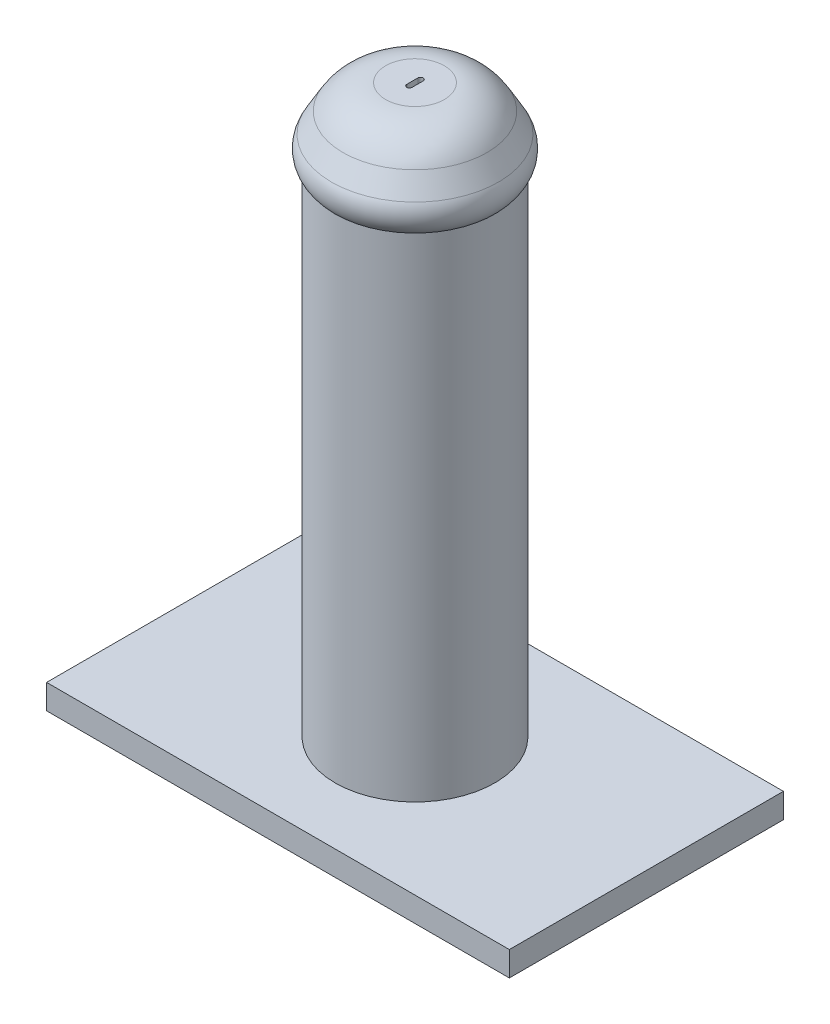
from build123d import *

# Parameters (mm, degrees)
SKETCH2_R           = 32.411320863
BOSS_EXTRUDE1_DEPTH = 200
SKETCH3_R           = 40.764441706
BOSS_EXTRUDE2_DEPTH = 30
BOSS_EXTRUDE2_TAPER = 30
FILLET1_R           = 10
FILLET2_R           = 20
CUT_EXTRUDE1_DEPTH  = 10
SKETCH5_W           = 187.852552736
SKETCH5_H           = 111.255195094
BOSS_EXTRUDE3_DEPTH = 10


with BuildPart() as part:
    # Sketch2 → Boss-Extrude1 (new body)
    with BuildSketch(Plane(origin=(0, 0, 0), x_dir=(1, 0, 0), z_dir=(0, 1, 0))):
        with Locations(Location((0, 0, 0), (0, 0, 270))):
            Circle(SKETCH2_R)
    extrude(amount=BOSS_EXTRUDE1_DEPTH)

    # Sketch3 → Boss-Extrude2 (add)
    with BuildSketch(Plane(origin=(0, 200, 0), x_dir=(1, 0, 0), z_dir=(0, 1, 0))):
        Circle(SKETCH3_R)
    extrude(amount=BOSS_EXTRUDE2_DEPTH, taper=BOSS_EXTRUDE2_TAPER)

    # Fillet1
    # the kernel refuses this fillet: 10 mm, written as the material it takes off along each edge
    with BuildSketch(Plane(origin=(0, 200, 0), x_dir=(1, 0, 0), z_dir=(0, 0, 1))) as fillet1_piece_1:
        with BuildLine():
            CenterArc((25.210979619, 6.93938657), FILLET1_R, 316.057297886, 73.942702114)
            Line((32.411320863, 0), (32.555327688, -0.138787731))
            ThreePointArc((32.555327688, -0.138787731), (36.587881285, -0.2), (40.764441706, -0.2))
            Line((40.764441706, -0.2), (40.937646787, 0.1))
            Line((40.937646787, 0.1), (34.044438737, 12.03938657))
            Line((34.044438737, 12.03938657), (33.871233656, 11.93938657))
        make_face()
    revolve(axis=Axis((0, 200, 0), (0, 1, 0)), mode=Mode.SUBTRACT)

    # Fillet2
    fillet2_edges = [part.edges().sort_by_distance(p)[0] for p in [
        (-23.443933631, 230, 0),
    ]]
    fillet(fillet2_edges, radius=FILLET2_R)

    # Sketch4 → Cut-Extrude1 (cut)
    with BuildSketch(Plane(origin=(0, 230, 0), x_dir=(1, 0, 0), z_dir=(0, 1, 0))):
        with BuildLine():
            Line((1.070724985, 2.258315279), (1.070724985, -2.258315279))
            ThreePointArc((1.070724985, -2.258315279), (0, -3.329040264), (-1.070724985, -2.258315279))
            Line((-1.070724985, -2.258315279), (-1.070724985, 2.258315279))
            ThreePointArc((-1.070724985, 2.258315279), (0, 3.329040264), (1.070724985, 2.258315279))
        make_face()
    extrude(amount=-CUT_EXTRUDE1_DEPTH, mode=Mode.SUBTRACT)

    # Sketch5 → Boss-Extrude3 (add)
    with BuildSketch(Plane.XZ):
        Rectangle(SKETCH5_W, SKETCH5_H)
    extrude(amount=BOSS_EXTRUDE3_DEPTH)


solid = part.part
